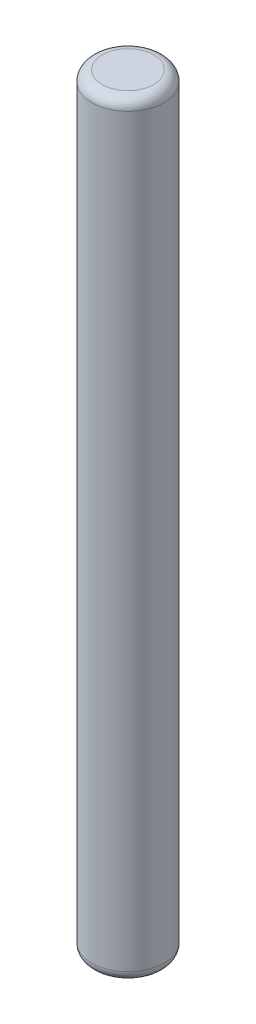
from build123d import *

# Parameters (mm, degrees)
ESQUISSE1_R        = 3.45
BOSS_EXTRU_1_DEPTH = 73
CONG_1_R           = 1


with BuildPart() as part:
    # Esquisse1 → Boss.-Extru.1 (new body)
    with BuildSketch(Plane(origin=(0, 0, 0), x_dir=(1, 0, 0), z_dir=(0, 1, 0))):
        Circle(ESQUISSE1_R)
    extrude(amount=BOSS_EXTRU_1_DEPTH)

    # Congé1
    cong_1_edges = [part.edges().sort_by_distance(p)[0] for p in [
        (-3.45, 73, 0),
        (-3.45, 0, 0),
    ]]
    fillet(cong_1_edges, radius=CONG_1_R)


solid = part.part
